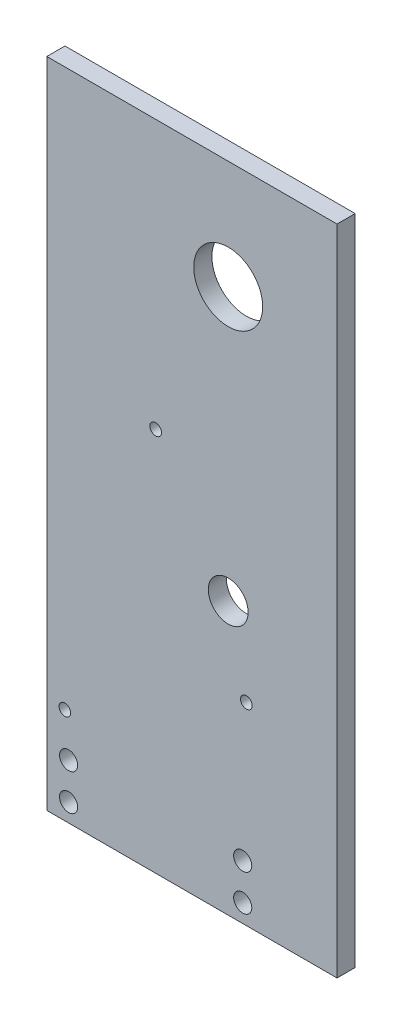
from build123d import *

# Parameters (mm, degrees)
SKETCH1_W           = 80
SKETCH1_H           = 180
SKETCH1_R           = 9.5
BOSS_EXTRUDE1_DEPTH = 5
SKETCH2_R           = 5.5
CUT_EXTRUDE1_DEPTH  = 30
SKETCH3_R           = 1.6
SKETCH3_R_2         = 2.5
CUT_EXTRUDE2_DEPTH  = 5


with BuildPart() as part:
    # Sketch1 → Boss-Extrude1 (new body)
    with BuildSketch(Plane.XY):
        with Locations((10, 166)):
            Rectangle(SKETCH1_W, SKETCH1_H)
        with Locations((20, 226)):
            Circle(SKETCH1_R, mode=Mode.SUBTRACT)
    extrude(amount=BOSS_EXTRUDE1_DEPTH)

    # Sketch2 → Cut-Extrude1 (cut)
    with BuildSketch(Plane.XY.offset(5)):
        with Locations((20, 151)):
            Circle(SKETCH2_R)
    extrude(amount=-CUT_EXTRUDE1_DEPTH, mode=Mode.SUBTRACT)

    # Sketch3 → Cut-Extrude2 (cut)
    with BuildSketch(Plane.XY.offset(5)):
        with Locations((0, 182)):
            Circle(SKETCH3_R)
        with Locations((25, 129.301270189)):
            Circle(SKETCH3_R)
        with Locations((-25.032859693, 102.533479235)):
            Circle(SKETCH3_R)
        with Locations((-24, 81)):
            Circle(SKETCH3_R_2)
        with Locations((24, 81)):
            Circle(SKETCH3_R_2)
        with Locations((24, 91)):
            Circle(SKETCH3_R_2)
        with Locations((-24, 91)):
            Circle(SKETCH3_R_2)
    extrude(amount=-CUT_EXTRUDE2_DEPTH, mode=Mode.SUBTRACT)


solid = part.part
